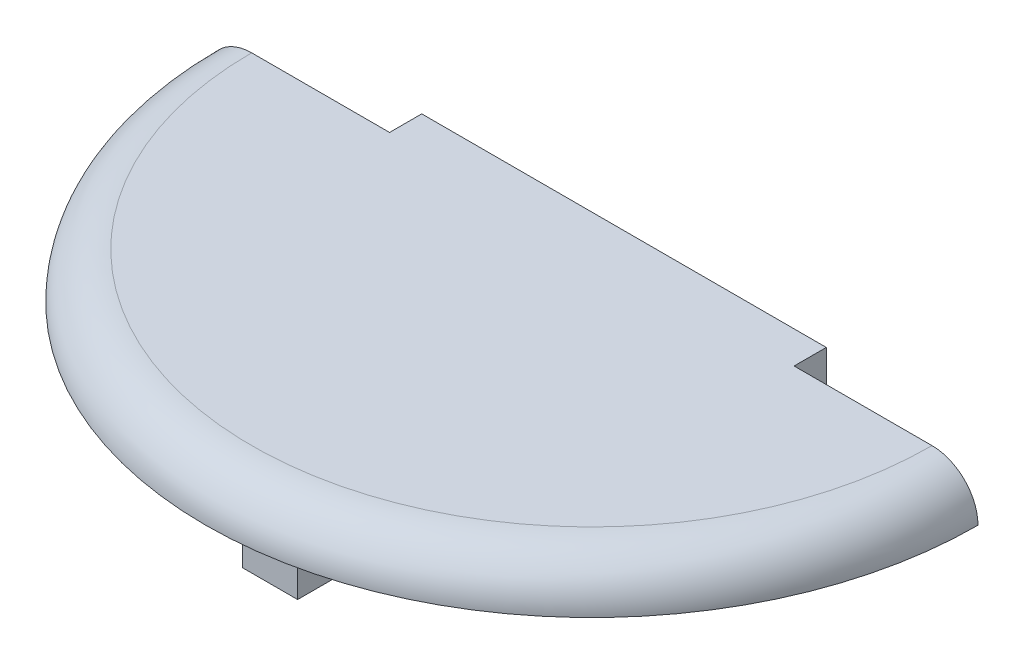
from build123d import *

# Parameters (mm, degrees)
CUT_EXTRUDE1_DEPTH       = 5
CUT_EXTRUDE3_DEPTH       = 45
SKETCH8_R                = 40
CUT_EXTRUDE4_DEPTH       = 32
SKETCH9_R                = 32
SKETCH9_R_2              = 24.5
CUT_EXTRUDE5_DEPTH       = 14
SKETCH10_R               = 26
CUT_EXTRUDE6_DEPTH       = 14
FILLET1_R                = 7
FILLET2_R                = 7
CUT_REVOLVE1_START       = 22
CUT_REVOLVE1_DEPTH       = 30.5
CUT_EXTRUDE12_DEPTH      = 5
SKETCH18_W               = 13
SKETCH18_H               = 8
CUT_EXTRUDE13_DEPTH      = 5
INTERSECT1_OUTLINE_R     = 42
INTERSECT1_DEPTH         = 55
SKETCH20_W               = 6
SKETCH20_H               = 3
BOSS_EXTRUDE1_DEPTH      = 8
BOSS_EXTRUDE2_DEPTH      = 1
BOSS_EXTRUDE2_DEPTH_BACK = 1
SKETCH21_W               = 6
SKETCH21_H               = 6
BOSS_EXTRUDE3_DEPTH      = 7
SKETCH19_R               = 1.35
CUT_EXTRUDE14_DEPTH      = 8
SKETCH23_W               = 20
SKETCH23_H               = 7
CUT_EXTRUDE15_DEPTH      = 7
SKETCH24_W               = 44
SKETCH24_H               = 3.5
CUT_EXTRUDE16_DEPTH      = 5


with BuildPart() as part:
    # Sketch1 → Revolve1 (revolve)
    with BuildSketch(Plane.XY, mode=Mode.PRIVATE) as revolve1_sk:
        with BuildLine():
            Line((22.5, 0), (32, 0))
            ThreePointArc((32, 0), (33.414213562, 0.585786438), (34, 2))
            Line((34, 2), (34, 18))
            Line((34, 18), (40, 18))
            ThreePointArc((40, 18), (41.414213562, 18.585786438), (42, 20))
            Line((42, 20), (42, 55))
            ThreePointArc((42, 55), (40.535533906, 58.535533906), (37, 60))
            Line((37, 60), (0, 60))
            Line((0, 60), (0, 18))
            Line((0, 18), (22.5, 18))
            Line((22.5, 18), (22.5, 0))
        make_face()
    revolve(revolve1_sk.sketch.rotate(Axis((0, 2, 0), (0, 1, 0)), 90), axis=Axis((0, 2, 0), (0, 1, 0)))

    # Sketch5 → Cut-Extrude1 (cut)
    with BuildSketch(Plane(origin=(0, 60, 0), x_dir=(1, 0, 0), z_dir=(0, 1, 0))):
        with BuildLine():
            Line((-42, 0), (-40, 0))
            Line((-40, 0), (40, 0))
            Line((40, 0), (42, 0))
            ThreePointArc((42, 0), (0, 42), (-42, 0))
        make_face()
    extrude(amount=-CUT_EXTRUDE1_DEPTH, mode=Mode.SUBTRACT)

    # Sketch7 → Cut-Extrude3 (cut)
    with BuildSketch(Plane.XZ.offset(-18)):
        with BuildLine():
            Line((-21, 0), (21, 0))
            ThreePointArc((21, 0), (0, -21), (-21, 0))
        make_face()
    extrude(amount=-CUT_EXTRUDE3_DEPTH, mode=Mode.SUBTRACT)

    # Sketch8 → Cut-Extrude4 (cut)
    with BuildSketch(Plane(origin=(0, 52.5, 0), x_dir=(1, 0, 0), z_dir=(0, 1, 0))):
        with Locations(Location((0, 0, 0), (0, 0, 270))):
            Circle(SKETCH8_R)
        with BuildLine():
            Line((22.912878475, -2), (-22.912878475, -2))
            ThreePointArc((-22.912878475, -2), (0, 23), (22.912878475, -2))
        make_face(mode=Mode.SUBTRACT)
    extrude(amount=-CUT_EXTRUDE4_DEPTH, mode=Mode.SUBTRACT)

    # Sketch9 → Cut-Extrude5 (cut)
    with BuildSketch(Plane(origin=(0, 2, 0), x_dir=(-1, 0, 0), z_dir=(0, -1, 0))):
        with Locations(Location((0, 0, 0), (0, 0, 90))):
            Circle(SKETCH9_R)
        with Locations(Location((0, 0, 0), (0, 0, 90))):
            Circle(SKETCH9_R_2, mode=Mode.SUBTRACT)
    extrude(amount=-CUT_EXTRUDE5_DEPTH, mode=Mode.SUBTRACT)

    # Sketch10 → Cut-Extrude6 (cut)
    with BuildSketch(Plane(origin=(0, 2, 0), x_dir=(-1, 0, 0), z_dir=(0, -1, 0))):
        Circle(SKETCH10_R)
    extrude(amount=-CUT_EXTRUDE6_DEPTH, mode=Mode.SUBTRACT)

    # Fillet1
    fillet1_edges = [part.edges().sort_by_distance(p)[0] for p in [
        (21, 36.5, 0),
        (-21, 36.5, 0),
    ]]
    fillet(fillet1_edges, radius=FILLET1_R)

    # Fillet2
    fillet2_edges = [part.edges().sort_by_distance(p)[0] for p in [
        (-22.912878475, 36.5, 2),
        (22.912878475, 36.5, 2),
    ]]
    fillet(fillet2_edges, radius=FILLET2_R)

    # Cut-Revolve1: read off the stored shape, not the designer's step
    # Cut-Revolve1 outline → Cut-Revolve1 (cut)
    with BuildSketch(Plane(origin=(0, 0, 0), x_dir=(1, 0, 0), z_dir=(0, 1, 0)).offset(CUT_REVOLVE1_START)):
        with BuildLine():
            Line((-34.641016151, -20), (-36.373066959, -21))
            ThreePointArc((-36.373066959, -21), (0, -42), (36.373066959, -21))
            Line((36.373066959, -21), (34.641016151, -20))
            ThreePointArc((34.641016151, -20), (0, -40), (-34.641016151, -20))
        make_face()
    extrude(amount=CUT_REVOLVE1_DEPTH, mode=Mode.SUBTRACT)

    # Sketch15 → Cut-Extrude12 (cut)
    with BuildSketch(Plane(origin=(0, 20.5, 0), x_dir=(1, 0, 0), z_dir=(0, 1, 0))):
        with BuildLine():
            Line((-28.124355653, -3.514579578), (-26.124355653, -3.514579578))
            ThreePointArc((-26.124355653, -3.514579578), (-24.710142091, -2.928793141), (-24.124355653, -1.514579578))
            Line((-24.124355653, -1.514579578), (-24.124355653, 8.485420422))
            ThreePointArc((-24.124355653, 8.485420422), (-24.710142091, 9.899633984), (-26.124355653, 10.485420422))
            Line((-26.124355653, 10.485420422), (-28.124355653, 10.485420422))
            ThreePointArc((-28.124355653, 10.485420422), (-29.538569215, 9.899633984), (-30.124355653, 8.485420422))
            Line((-30.124355653, 8.485420422), (-30.124355653, -1.514579578))
            ThreePointArc((-30.124355653, -1.514579578), (-29.538569215, -2.928793141), (-28.124355653, -3.514579578))
        make_face()
    extrude(amount=-CUT_EXTRUDE12_DEPTH, mode=Mode.SUBTRACT)

    # Sketch18 → Cut-Extrude13 (cut)
    with BuildSketch(Plane(origin=(0, 55, 0), x_dir=(1, 0, 0), z_dir=(0, 1, 0))):
        with Locations((0.796512215, 32.951769165)):
            Rectangle(SKETCH18_W, SKETCH18_H)
    extrude(amount=-CUT_EXTRUDE13_DEPTH, mode=Mode.SUBTRACT)

    # Intersect1: read off the stored shape, not the designer's step
    # Intersect1 outline → Intersect1 (cut)
    with BuildSketch(Plane(origin=(0, 0, 0), x_dir=(1, 0, 0), z_dir=(0, 1, 0))):
        Circle(INTERSECT1_OUTLINE_R)
        with BuildLine():
            Line((12.124355653, 0), (-12.124355653, 0))
            ThreePointArc((-12.124355653, 0), (-18.186533479, 3.5), (-18.186533479, 10.5))
            ThreePointArc((-18.186533479, 10.5), (0, 21), (18.186533479, 10.5))
            ThreePointArc((18.186533479, 10.5), (18.186533479, 3.5), (12.124355653, 0))
        make_face(mode=Mode.SUBTRACT)
    extrude(amount=INTERSECT1_DEPTH, mode=Mode.SUBTRACT)

    # Sketch20 → Boss-Extrude1 (add)
    with BuildSketch(Plane.XZ.offset(-55)):
        with Locations((0, 33.5)):
            Rectangle(SKETCH20_W, SKETCH20_H)
    extrude(amount=BOSS_EXTRUDE1_DEPTH)

    # Sketch21 → Boss-Extrude2 (add, two sides: drawn at the far end of the back side and taken through both)
    with BuildSketch(Plane.XZ.offset(-47).offset(-BOSS_EXTRUDE2_DEPTH_BACK)):
        with Locations((0, 32)):
            Rectangle(SKETCH21_W, SKETCH21_H)
    extrude(amount=BOSS_EXTRUDE2_DEPTH + BOSS_EXTRUDE2_DEPTH_BACK)

    # Sketch22 → Boss-Extrude3 (add)
    with BuildSketch(Plane(origin=(0, 0, 0), x_dir=(-1, 0, 0), z_dir=(0, 0, -1))):
        with BuildLine():
            Line((-42, 55), (42, 55))
            ThreePointArc((42, 55), (40.535533906, 58.535533906), (37, 60))
            Line((37, 60), (-37, 60))
            ThreePointArc((-37, 60), (-40.535533906, 58.535533906), (-42, 55))
        make_face()
    extrude(amount=BOSS_EXTRUDE3_DEPTH)

    # Sketch19 → Cut-Extrude14 (cut)
    with BuildSketch(Plane(origin=(0, 0, -7), x_dir=(-1, 0, 0), z_dir=(0, 0, -1))):
        with Locations((0, 57.5)):
            Circle(SKETCH19_R)
        with Locations((-30, 57.5)):
            Circle(SKETCH19_R)
        with Locations((30, 57.5)):
            Circle(SKETCH19_R)
    extrude(amount=-CUT_EXTRUDE14_DEPTH, mode=Mode.SUBTRACT)

    # Sketch23 → Cut-Extrude15 (cut)
    with BuildSketch(Plane(origin=(0, 60, 0), x_dir=(1, 0, 0), z_dir=(0, 1, 0))):
        with Locations((-32, 3.5)):
            Rectangle(SKETCH23_W, SKETCH23_H)
        with Locations((32, 3.5)):
            Rectangle(SKETCH23_W, SKETCH23_H)
    extrude(amount=-CUT_EXTRUDE15_DEPTH, mode=Mode.SUBTRACT)

    # Sketch24 → Cut-Extrude16 (cut)
    with BuildSketch(Plane(origin=(0, 60, 0), x_dir=(1, 0, 0), z_dir=(0, 1, 0))):
        with Locations((0, 5.25)):
            Rectangle(SKETCH24_W, SKETCH24_H)
    extrude(amount=-CUT_EXTRUDE16_DEPTH, mode=Mode.SUBTRACT)


solid = part.part
